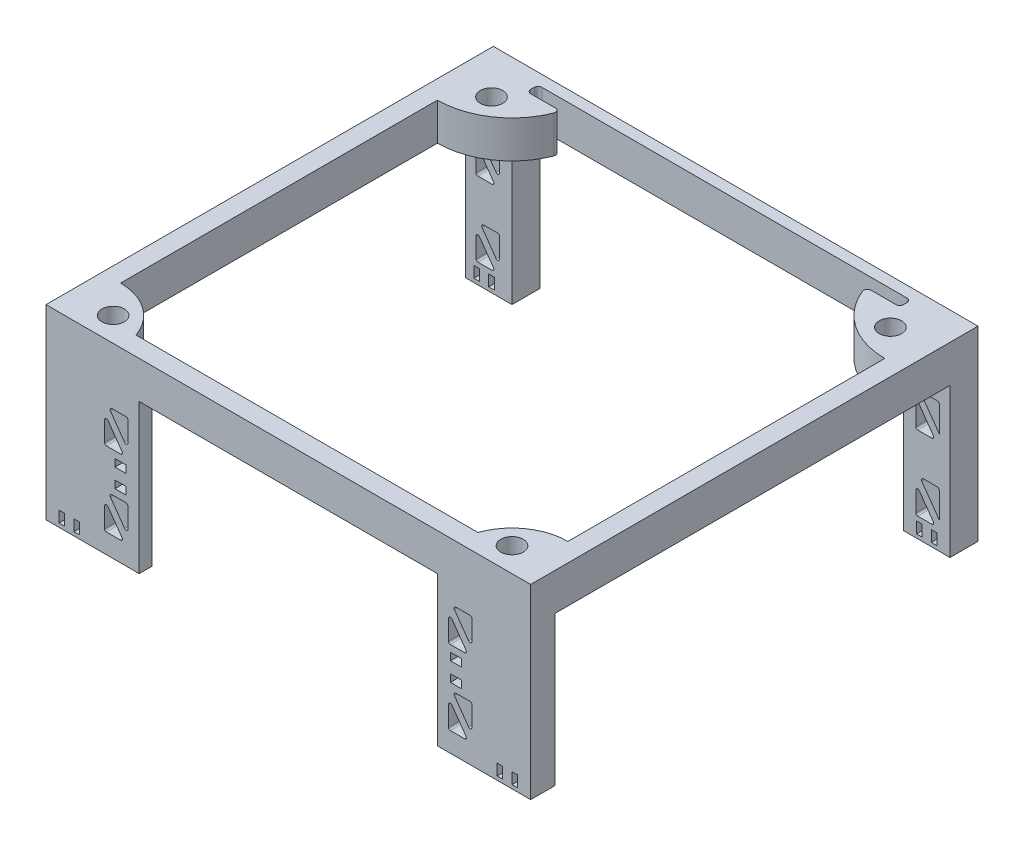
from build123d import *

# Parameters (mm, degrees)
SKETCH1_W               = 130
SKETCH1_H               = 120
SKETCH1_R               = 3
BOSS_EXTRUDE1_DEPTH     = 10
SKETCH2_W               = 100
SKETCH2_H               = 3
CUT_EXTRUDE1_DEPTH      = 10
FILLET1_R               = 1
FILLET2_R               = 1
FILLET3_R               = 1
SKETCH3_W               = 12.5
SKETCH3_H               = 7.5
BOSS_EXTRUDE2_DEPTH     = 40
CUT_EXTRUDE2_DEPTH      = 40
FILLET4_R               = 0.5
BOSS_EXTRUDE4_START     = 40
BOSS_EXTRUDE4_DEPTH     = 40
CUT_EXTRUDE10_DEPTH     = 6.5
FILLET5_R               = 0.5
FILLET6_R               = 0.5
FILLET7_R               = 0.5
FILLET8_R               = 0.5
FILLET9_R               = 0.5
FILLET10_R              = 0.5
SKETCH11_W              = 3
SKETCH11_H              = 2
CUT_EXTRUDE16_DEPTH     = 10
SKETCH12_W              = 1.5
SKETCH12_H              = 3
CUT_EXTRUDE18_DEPTH     = 10
FILLET13_R              = 3
FILLET14_R              = 3
CUT_EXTRUDE19_START     = -39.000340558
CUT_EXTRUDE19_OUTLINE_W = 1.5
CUT_EXTRUDE19_OUTLINE_H = 6.5
CUT_EXTRUDE19_DEPTH     = 3


# Read off the part's stored shape, not the designer's step: Cut-Extrude19
with BuildPart() as part:
    # Sketch1 → Boss-Extrude1 (new body)
    with BuildSketch(Plane(origin=(0, 0, 0), x_dir=(1, 0, 0), z_dir=(0, 1, 0))):
        with Locations((60, 60)):
            Rectangle(SKETCH1_W, SKETCH1_H)
        with Locations(Location((6.5, 6.5, 0), (0, 0, 270))):
            Circle(SKETCH1_R, mode=Mode.SUBTRACT)
        with Locations(Location((113.5, 6.5, 0), (0, 0, 270))):
            Circle(SKETCH1_R, mode=Mode.SUBTRACT)
        with Locations(Location((6.5, 108, 0), (0, 0, 270))):
            Circle(SKETCH1_R, mode=Mode.SUBTRACT)
        with Locations(Location((113.5, 108, 0), (0, 0, 270))):
            Circle(SKETCH1_R, mode=Mode.SUBTRACT)
        with BuildLine():
            Line((0, 100), (0, 15))
            ThreePointArc((0, 15), (8.660254038, 12.247448714), (14.142135624, 5))
            Line((14.142135624, 5), (15, 5))
            Line((15, 5), (105, 5))
            Line((105, 5), (105.857864376, 5))
            ThreePointArc((105.857864376, 5), (111.339745962, 12.247448714), (120, 15))
            Line((120, 15), (120, 100))
            ThreePointArc((120, 100), (107.752551286, 104.188611699), (100.635083269, 115))
            Line((100.635083269, 115), (100, 115))
            Line((100, 115), (20, 115))
            Line((20, 115), (19.364916731, 115))
            ThreePointArc((19.364916731, 115), (12.247448714, 104.188611699), (0, 100))
        make_face(mode=Mode.SUBTRACT)
    extrude(amount=BOSS_EXTRUDE1_DEPTH)

    # Sketch2 → Cut-Extrude1 (cut)
    with BuildSketch(Plane(origin=(0, 10, 0), x_dir=(1, 0, 0), z_dir=(0, 1, 0))):
        with Locations((60, 115.5)):
            Rectangle(SKETCH2_W, SKETCH2_H)
    extrude(amount=-CUT_EXTRUDE1_DEPTH, mode=Mode.SUBTRACT)

    # Fillet1
    fillet1_edges = [part.edges().sort_by_distance(p)[0] for p in [
        (110, 5, -114),
        (10, 5, -114),
        (10, 5, -117),
        (110, 5, -117),
    ]]
    fillet(fillet1_edges, radius=FILLET1_R)

    # Fillet2
    fillet2_edges = [part.edges().sort_by_distance(p)[0] for p in [
        (19.078784028, 5, -114),
    ]]
    fillet(fillet2_edges, radius=FILLET2_R)

    # Fillet3
    fillet3_edges = [part.edges().sort_by_distance(p)[0] for p in [
        (100.921215972, 5, -114),
    ]]
    fillet(fillet3_edges, radius=FILLET3_R)

    # Sketch3 → Boss-Extrude2 (add)
    with BuildSketch(Plane.XZ):
        with Locations((1.25, -116.25)):
            Rectangle(SKETCH3_W, SKETCH3_H)
        with Locations((118.75, -116.25)):
            Rectangle(SKETCH3_W, SKETCH3_H)
    extrude(amount=BOSS_EXTRUDE2_DEPTH)

    # Sketch4 → Cut-Extrude2 (cut)
    with BuildSketch(Plane.XY.offset(-112.5)):
        Polygon((4.146286764, -25.3), (4.146286764, -32.711764706), (-1.103713236, -25.3), align=None)
        Polygon((-2.137953431, -7.3), (-2.137953431, -14.711764706), (3.112046569, -14.711764706), align=None)
        Polygon((4.146286764, -5.3), (4.146286764, -12.711764706), (-1.103713236, -5.3), align=None)
        Polygon((115.829800582, -27.3), (115.829800582, -34.711764706), (121.079800582, -34.711764706), align=None)
        Polygon((122.114040776, -25.3), (122.114040776, -32.711764706), (116.864040776, -25.3), align=None)
        Polygon((115.829800582, -7.3), (115.829800582, -14.711764706), (121.079800582, -14.711764706), align=None)
        Polygon((122.114040776, -5.3), (122.114040776, -12.711764706), (116.864040776, -5.3), align=None)
        Polygon((-2.137953431, -34.711764706), (3.112046569, -34.711764706), (-2.137953431, -27.3), align=None)
    extrude(amount=-CUT_EXTRUDE2_DEPTH, mode=Mode.SUBTRACT)

    # Fillet4
    fillet4_edges = [part.edges().sort_by_distance(p)[0] for p in [
        (4.146286764, -12.711764706, -116.25),
        (-1.103713236, -5.3, -116.25),
        (4.146286764, -5.3, -116.25),
        (-2.137953431, -7.3, -116.25),
        (3.112046569, -14.711764706, -116.25),
        (-2.137953431, -14.711764706, -116.25),
        (122.114040776, -25.3, -116.25),
        (116.864040776, -25.3, -116.25),
        (115.829800582, -34.711764706, -116.25),
        (115.829800582, -27.3, -116.25),
        (121.079800582, -34.711764706, -116.25),
        (122.114040776, -5.3, -116.25),
        (116.864040776, -5.3, -116.25),
        (115.829800582, -14.711764706, -116.25),
        (115.829800582, -7.3, -116.25),
        (121.079800582, -14.711764706, -116.25),
        (-2.137953431, -34.711764706, -116.25),
        (-2.137953431, -27.3, -116.25),
        (3.112046569, -34.711764706, -116.25),
        (4.146286764, -25.3, -116.25),
        (4.146286764, -32.711764706, -116.25),
        (-1.103713236, -25.3, -116.25),
    ]]
    fillet(fillet4_edges, radius=FILLET4_R)

    # Sketch7 → Boss-Extrude4 (add)
    with BuildSketch(Plane(origin=(0, 0, 0), x_dir=(-1, 0, 0), z_dir=(0, -1, 0)).offset(BOSS_EXTRUDE4_START)):
        with BuildLine():
            Line((-125, 0), (-100, 0))
            Line((-100, 0), (-100, 3.5))
            Line((-100, 3.5), (-106.481494165, 3.5))
            Line((-106.481494165, 3.5), (-106.481494165, 6.5))
            Line((-106.481494165, 6.5), (-110.5, 6.5))
            ThreePointArc((-110.5, 6.5), (-113.5, 3.5), (-116.5, 6.5))
            Line((-116.5, 6.5), (-125, 6.5))
            Line((-125, 6.5), (-125, 0))
        make_face()
        with BuildLine():
            Line((-20, 0), (5, 0))
            Line((5, 0), (5, 6.5))
            Line((5, 6.5), (-3.5, 6.5))
            ThreePointArc((-3.5, 6.5), (-6.5, 3.5), (-9.5, 6.5))
            Line((-9.5, 6.5), (-13.518505835, 6.5))
            Line((-13.518505835, 6.5), (-13.518505835, 3.5))
            Line((-13.518505835, 3.5), (-20, 3.5))
            Line((-20, 3.5), (-20, 0))
        make_face()
    extrude(amount=-BOSS_EXTRUDE4_DEPTH)

    # Sketch8 → Cut-Extrude10 (cut)
    with BuildSketch(Plane.XY):
        Polygon((10.705890153, -7.3), (10.705890153, -14.711764706), (15.955890153, -14.711764706), align=None)
        Polygon((16.990130348, -5.3), (16.990130348, -12.711764706), (11.740130348, -5.3), align=None)
        Polygon((16.990130348, -25.3), (16.990130348, -32.711764706), (11.740130348, -25.3), align=None)
        Polygon((10.705890153, -27.3), (10.705890153, -34.711764706), (15.955890153, -34.711764706), align=None)
        Polygon((102.973841536, -27.3), (102.973841536, -34.711764706), (108.223841536, -34.711764706), align=None)
        Polygon((109.258081731, -25.3), (109.258081731, -32.711764706), (104.008081731, -25.3), align=None)
        Polygon((102.973841536, -7.3), (102.973841536, -14.711764706), (108.223841536, -14.711764706), align=None)
        Polygon((109.258081731, -5.3), (109.258081731, -12.711764706), (104.008081731, -5.3), align=None)
    extrude(amount=-CUT_EXTRUDE10_DEPTH, mode=Mode.SUBTRACT)

    # Fillet5
    fillet5_edges = [part.edges().sort_by_distance(p)[0] for p in [
        (108.223841536, -34.711764706, -3.25),
        (15.955890153, -34.711764706, -1.75),
        (108.223841536, -14.711764706, -3.25),
        (15.955890153, -14.711764706, -1.75),
    ]]
    fillet(fillet5_edges, radius=FILLET5_R)

    # Fillet6
    fillet6_edges = [part.edges().sort_by_distance(p)[0] for p in [
        (102.973841536, -34.711764706, -1.75),
        (10.705890153, -34.711764706, -3.25),
        (102.973841536, -14.711764706, -1.75),
        (10.705890153, -14.711764706, -3.25),
    ]]
    fillet(fillet6_edges, radius=FILLET6_R)

    # Fillet7
    fillet7_edges = [part.edges().sort_by_distance(p)[0] for p in [
        (11.740130348, -25.3, -3.25),
        (11.740130348, -5.3, -3.25),
        (104.008081731, -5.3, -1.75),
        (104.008081731, -25.3, -1.75),
    ]]
    fillet(fillet7_edges, radius=FILLET7_R)

    # Fillet8
    fillet8_edges = [part.edges().sort_by_distance(p)[0] for p in [
        (16.990130348, -25.3, -1.75),
        (16.990130348, -5.3, -1.75),
        (109.258081731, -5.3, -3.25),
        (109.258081731, -25.3, -3.25),
    ]]
    fillet(fillet8_edges, radius=FILLET8_R)

    # Fillet9
    fillet9_edges = [part.edges().sort_by_distance(p)[0] for p in [
        (102.973841536, -27.3, -1.75),
        (10.705890153, -27.3, -3.25),
        (102.973841536, -7.3, -1.75),
        (10.705890153, -7.3, -3.25),
    ]]
    fillet(fillet9_edges, radius=FILLET9_R)

    # Fillet10
    fillet10_edges = [part.edges().sort_by_distance(p)[0] for p in [
        (16.990130348, -32.711764706, -1.75),
        (16.990130348, -12.711764706, -1.75),
        (109.258081731, -12.711764706, -3.25),
        (109.258081731, -32.711764706, -3.25),
    ]]
    fillet(fillet10_edges, radius=FILLET10_R)

    # Sketch11 → Cut-Extrude16 (cut)
    with BuildSketch(Plane.XY):
        with Locations((105, -17.5)):
            Rectangle(SKETCH11_W, SKETCH11_H)
        with Locations((105, -22.5)):
            Rectangle(SKETCH11_W, SKETCH11_H)
        with Locations((15, -17.5)):
            Rectangle(SKETCH11_W, SKETCH11_H)
        with Locations((15, -22.5)):
            Rectangle(SKETCH11_W, SKETCH11_H)
    extrude(amount=-CUT_EXTRUDE16_DEPTH, mode=Mode.SUBTRACT)

    # Sketch12 → Cut-Extrude18 (cut)
    with BuildSketch(Plane(origin=(0, 0, -120), x_dir=(-1, 0, 0), z_dir=(0, 0, -1))):
        with Locations((-120.75, -37.5)):
            Rectangle(SKETCH12_W, SKETCH12_H)
        with Locations((-116.75, -37.5)):
            Rectangle(SKETCH12_W, SKETCH12_H)
        with Locations((2, -37.5)):
            Rectangle(SKETCH12_W, SKETCH12_H)
        with Locations((-2, -37.5)):
            Rectangle(SKETCH12_W, SKETCH12_H)
    extrude(amount=-CUT_EXTRUDE18_DEPTH, mode=Mode.SUBTRACT)

    # Fillet13
    # the kernel refuses this fillet: 3 mm, written as the material it takes off along each edge
    with BuildSketch(Plane(origin=(106.481494165, -47.5, -6.5), x_dir=(0, 0, 1), z_dir=(0, 1, 0))) as fillet13_piece_1:
        with BuildLine():
            CenterArc((FILLET13_R, FILLET13_R), FILLET13_R, 180, 90)
            Line((0, FILLET13_R), (0, 0))
            Line((0, 0), (FILLET13_R, 0))
        make_face()
    extrude(amount=20.288235294, mode=Mode.SUBTRACT)
    with BuildSketch(Plane(origin=(106.481494165, -39.751980182, -6.5), x_dir=(1, 0, 0), z_dir=(0, 1, 0)), Plane(origin=(106.481494165, -19.751980182, -6.5), x_dir=(1, 0, 0), z_dir=(0, 1, 0))) as fillet13_piece_2:
        with BuildLine():
            CenterArc((FILLET13_R, -FILLET13_R), FILLET13_R, 90, 90)
            Line((0, -FILLET13_R), (0, 0))
            Line((0, 0), (FILLET13_R, 0))
        make_face()
    extrude(amount=18.460103805, mode=Mode.SUBTRACT)
    with BuildSketch(Plane(origin=(106.481494165, -32.8, -6.5), x_dir=(1, 0, 0), z_dir=(0, 1, 0))) as fillet13_piece_3:
        with BuildLine():
            CenterArc((FILLET13_R, -FILLET13_R), FILLET13_R, 90, 90)
            Line((0, -FILLET13_R), (0, 0))
            Line((0, 0), (FILLET13_R, 0))
        make_face()
    extrude(amount=16.8, mode=Mode.SUBTRACT)
    with BuildSketch(Plane(origin=(106.481494165, -12.8, -6.5), x_dir=(1, 0, 0), z_dir=(0, 1, 0))) as fillet13_piece_4:
        with BuildLine():
            CenterArc((FILLET13_R, -FILLET13_R), FILLET13_R, 90, 90)
            Line((0, -FILLET13_R), (0, 0))
            Line((0, 0), (FILLET13_R, 0))
        make_face()
    extrude(amount=12.8, mode=Mode.SUBTRACT)
    with BuildSketch(Plane(origin=(106.481494165, -29, -6.5), x_dir=(1, 0, 0), z_dir=(0, 1, 0))) as fillet13_piece_5:
        with BuildLine():
            CenterArc((FILLET13_R, -FILLET13_R), FILLET13_R, 90, 90)
            Line((0, -FILLET13_R), (0, 0))
            Line((0, 0), (FILLET13_R, 0))
        make_face()
    extrude(amount=18, mode=Mode.SUBTRACT)
    with BuildSketch(Plane(origin=(106.481494165, -24, -6.5), x_dir=(1, 0, 0), z_dir=(0, 1, 0))) as fillet13_piece_6:
        with BuildLine():
            CenterArc((FILLET13_R, -FILLET13_R), FILLET13_R, 90, 90)
            Line((0, -FILLET13_R), (0, 0))
            Line((0, 0), (FILLET13_R, 0))
        make_face()
    extrude(amount=16.788235294, mode=Mode.SUBTRACT)

    # Fillet14
    # the kernel refuses this fillet: 3 mm, written as the material it takes off along each edge
    with BuildSketch(Plane(origin=(13.518505835, -47.5, -6.5), x_dir=(-1, 0, 0), z_dir=(0, 1, 0))) as fillet14_piece_1:
        with BuildLine():
            CenterArc((FILLET14_R, FILLET14_R), FILLET14_R, 180, 90)
            Line((0, FILLET14_R), (0, 0))
            Line((0, 0), (FILLET14_R, 0))
        make_face()
    extrude(amount=20.288235294, mode=Mode.SUBTRACT)
    with BuildSketch(Plane(origin=(13.518505835, -38.77075155, -6.5), x_dir=(-1, 0, 0), z_dir=(0, 1, 0)), Plane(origin=(13.518505835, -18.77075155, -6.5), x_dir=(-1, 0, 0), z_dir=(0, 1, 0))) as fillet14_piece_2:
        with BuildLine():
            CenterArc((FILLET14_R, FILLET14_R), FILLET14_R, 180, 90)
            Line((0, FILLET14_R), (0, 0))
            Line((0, 0), (FILLET14_R, 0))
        make_face()
    extrude(amount=18.460103805, mode=Mode.SUBTRACT)
    with BuildSketch(Plane(origin=(13.518505835, -32.8, -6.5), x_dir=(-1, 0, 0), z_dir=(0, 1, 0))) as fillet14_piece_3:
        with BuildLine():
            CenterArc((FILLET14_R, FILLET14_R), FILLET14_R, 180, 90)
            Line((0, FILLET14_R), (0, 0))
            Line((0, 0), (FILLET14_R, 0))
        make_face()
    extrude(amount=16.8, mode=Mode.SUBTRACT)
    with BuildSketch(Plane(origin=(13.518505835, -12.8, -6.5), x_dir=(0, 0, 1), z_dir=(0, 1, 0))) as fillet14_piece_4:
        with BuildLine():
            CenterArc((FILLET14_R, -FILLET14_R), FILLET14_R, 90, 90)
            Line((0, -FILLET14_R), (0, 0))
            Line((0, 0), (FILLET14_R, 0))
        make_face()
    extrude(amount=12.8, mode=Mode.SUBTRACT)
    with BuildSketch(Plane(origin=(13.518505835, -29, -6.5), x_dir=(-1, 0, 0), z_dir=(0, 1, 0))) as fillet14_piece_5:
        with BuildLine():
            CenterArc((FILLET14_R, FILLET14_R), FILLET14_R, 180, 90)
            Line((0, FILLET14_R), (0, 0))
            Line((0, 0), (FILLET14_R, 0))
        make_face()
    extrude(amount=18, mode=Mode.SUBTRACT)
    with BuildSketch(Plane(origin=(13.518505835, -24, -6.5), x_dir=(-1, 0, 0), z_dir=(0, 1, 0))) as fillet14_piece_6:
        with BuildLine():
            CenterArc((FILLET14_R, FILLET14_R), FILLET14_R, 180, 90)
            Line((0, FILLET14_R), (0, 0))
            Line((0, 0), (FILLET14_R, 0))
        make_face()
    extrude(amount=16.788235294, mode=Mode.SUBTRACT)

    # Cut-Extrude19 outline → Cut-Extrude19 (cut)
    with BuildSketch(Plane(origin=(0, 0, 0), x_dir=(1, 0, 0), z_dir=(0, 1, 0)).offset(CUT_EXTRUDE19_START)):
        with BuildLine():
            Line((116, 0), (117.5, 0))
            Line((117.5, 0), (117.5, 6.5))
            Line((117.5, 6.5), (116.5, 6.5))
            ThreePointArc((116.5, 6.5), (116.372281323, 5.633974596), (116, 4.841687605))
            Line((116, 4.841687605), (116, 0))
        make_face()
        with BuildLine():
            Line((2.5, 0), (4, 0))
            Line((4, 0), (4, 4.841687605))
            ThreePointArc((4, 4.841687605), (3.627718677, 5.633974596), (3.5, 6.5))
            Line((3.5, 6.5), (2.5, 6.5))
            Line((2.5, 6.5), (2.5, 0))
        make_face()
        with Locations((120.75, 3.25)):
            Rectangle(CUT_EXTRUDE19_OUTLINE_W, CUT_EXTRUDE19_OUTLINE_H)
        with Locations((-0.75, 3.25)):
            Rectangle(CUT_EXTRUDE19_OUTLINE_W, CUT_EXTRUDE19_OUTLINE_H)
    extrude(amount=CUT_EXTRUDE19_DEPTH, mode=Mode.SUBTRACT)


solid = part.part
